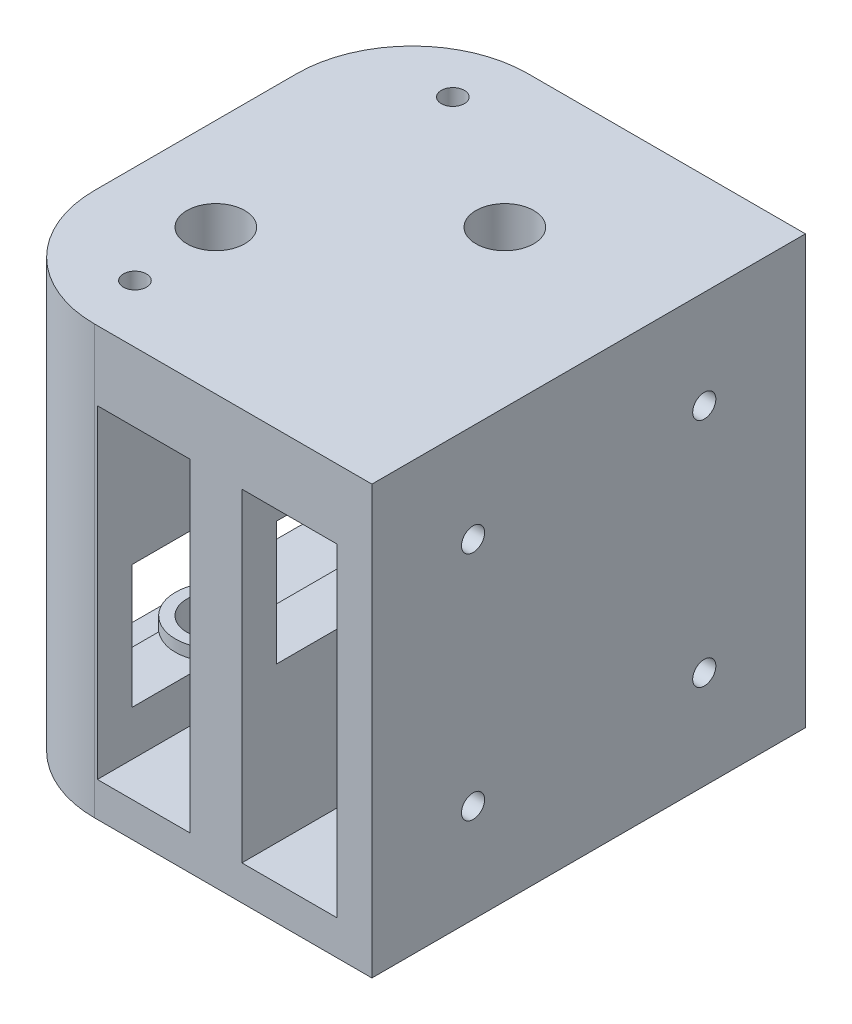
from build123d import *
from build123d.topology import SkipClean

# Parameters (mm, degrees)
TOP_SKETCH1_W                             = 34
TOP_SKETCH1_H                             = 37.5
TOP_SKETCH1_R                             = 1
TOP_SKETCH1_R_2                           = 2.5
BOSS_EXTRUDE4_DEPTH                       = 6
TOPRIGHTRISERBOSS_EXTRUDE5_START          = 14.4
TOPRIGHTRISER_R                           = 2.5
TOPRIGHTRISERBOSS_EXTRUDE5_DEPTH          = 14.4
TOPLEFTBOSS_EXTRUDE6_START                = 4.9
TOPLEFT_R                                 = 2.5
TOPLEFTBOSS_EXTRUDE6_DEPTH                = 4.9
MIDWALL_W                                 = 10.25
MIDWALL_H                                 = 3
MIDWALL_W_2                               = 4.5
MIDWALL_W_3                               = 3
MIDWALL_H_2                               = 37.5
MIDWALLBOSS_EXTRUDE7_DEPTH                = 28
BOTTOM_W                                  = 34
BOTTOM_H                                  = 37.5
BOTTOMBOSS_EXTRUDE8_DEPTH                 = 3
LOWERRIGHT_R                              = 2.5
LOWERRIGHTBOSS_EXTRUDE10_DEPTH            = 4.9
LOWERLEFT_R                               = 2.5
LOWERLEFTBOSS_EXTRUDE9_DEPTH              = 14.4
FILLET1_R                                 = 10
LINEARRAILMOUNTINGHOLES_SKETCH10_R        = 1
LINEARRAILMOUNTINGHOLESCUT_EXTRUDE1_DEPTH = 3
TOPRIGHTINSET_CUT_EXTRUDE1_DEPTH          = 1
TOPLEFTINSET_CUT_EXTRUDE2_DEPTH           = 1
LOWERLEFTINSET_CUT_EXTRUDE3_START         = -1
LOWERLEFTINSET_CUT_EXTRUDE3_DEPTH         = 1
LOWERRIGHTINSETCUT_EXTRUDE4_START         = -1
LOWERRIGHTINSETCUT_EXTRUDE4_DEPTH         = 1
PUSHPINHOLESKETCH1_R                      = 1
PUSHPINHOLECUT_EXTRUDE5_DEPTH             = 63.69968102


with BuildPart() as part:
    # Top-Sketch1 → Boss-Extrude4 (new body)
    with BuildSketch(Plane(origin=(0, 0, 0), x_dir=(1, 0, 0), z_dir=(0, 1, 0))):
        with Locations((17, 18.75)):
            Rectangle(TOP_SKETCH1_W, TOP_SKETCH1_H)
        with Locations(Location((8.5, 32.5, 0), (0, 0, 270))):
            Circle(TOP_SKETCH1_R, mode=Mode.SUBTRACT)
        with Locations(Location((8.5, 5, 0), (0, 0, 270))):
            Circle(TOP_SKETCH1_R, mode=Mode.SUBTRACT)
        with Locations(Location((8, 12.5, 0), (0, 0, 270))):
            Circle(TOP_SKETCH1_R_2, mode=Mode.SUBTRACT)
        with Locations(Location((20.5, 25, 0), (0, 0, 270))):
            Circle(TOP_SKETCH1_R_2, mode=Mode.SUBTRACT)
    extrude(amount=BOSS_EXTRUDE4_DEPTH)

    # TopRightRiser → TopRightRiserBoss-Extrude5 (add)
    with SkipClean():  # the faces are left unmerged after this step: merging them gives an invalid solid
        with BuildSketch(Plane.XZ.offset(TOPRIGHTRISERBOSS_EXTRUDE5_START)):
            with BuildLine():
                Line((5.75, -9.819048676), (5.75, 0))
                Line((5.75, 0), (10.25, 0))
                Line((10.25, 0), (10.25, -9.819048676))
                ThreePointArc((10.25, -9.819048676), (8, -16), (5.75, -9.819048676))
            make_face()
            with Locations(Location((8, -12.5, 0), (0, 0, 270))):
                Circle(TOPRIGHTRISER_R, mode=Mode.SUBTRACT)
        extrude(amount=-TOPRIGHTRISERBOSS_EXTRUDE5_DEPTH)

    # TopLeft → TopLeftBoss-Extrude6 (add)
    with SkipClean():  # the faces are left unmerged after this step: merging them gives an invalid solid
        with BuildSketch(Plane.XZ.offset(TOPLEFTBOSS_EXTRUDE6_START)):
            with BuildLine():
                Line((18.25, -22.319048676), (18.25, 0))
                Line((18.25, 0), (22.75, 0))
                Line((22.75, 0), (22.75, -22.319048676))
                ThreePointArc((22.75, -22.319048676), (20.5, -28.5), (18.25, -22.319048676))
            make_face()
            with Locations(Location((20.5, -25, 0), (0, 0, 270))):
                Circle(TOPLEFT_R, mode=Mode.SUBTRACT)
        extrude(amount=-TOPLEFTBOSS_EXTRUDE6_DEPTH)

    # MidWall → MidWallBoss-Extrude7 (add)
    with SkipClean():  # the faces are left unmerged after this step: merging them gives an invalid solid
        with BuildSketch(Plane(origin=(0, 0, 0), x_dir=(-1, 0, 0), z_dir=(0, -1, 0))):
            with Locations((-5.125, 1.5)):
                Rectangle(MIDWALL_W, MIDWALL_H)
            with Locations((-20.5, 1.5)):
                Rectangle(MIDWALL_W_2, MIDWALL_H)
            with Locations((-32.5, 18.75)):
                Rectangle(MIDWALL_W_3, MIDWALL_H_2)
        extrude(amount=MIDWALLBOSS_EXTRUDE7_DEPTH)

    # Bottom → BottomBoss-Extrude8 (add)
    with SkipClean():  # the faces are left unmerged after this step: merging them gives an invalid solid
        with BuildSketch(Plane.XZ.offset(28)):
            with Locations((17, -18.75)):
                Rectangle(BOTTOM_W, BOTTOM_H)
        extrude(amount=BOTTOMBOSS_EXTRUDE8_DEPTH)

    # LowerRight → LowerRightBoss-Extrude10 (add)
    with SkipClean():  # the faces are left unmerged after this step: merging them gives an invalid solid
        with BuildSketch(Plane(origin=(0, -28, 0), x_dir=(1, 0, 0), z_dir=(0, 1, 0))):
            with BuildLine():
                Line((5.75, 9.819048676), (5.75, 3))
                Line((5.75, 3), (10.25, 3))
                Line((10.25, 3), (10.25, 9.819048676))
                ThreePointArc((10.25, 9.819048676), (8, 16), (5.75, 9.819048676))
            make_face()
            with Locations(Location((8, 12.5, 0), (0, 0, 90))):
                Circle(LOWERRIGHT_R, mode=Mode.SUBTRACT)
        extrude(amount=LOWERRIGHTBOSS_EXTRUDE10_DEPTH)

    # LowerLeft → LowerLeftBoss-Extrude9 (add)
    with SkipClean():  # the faces are left unmerged after this step: merging them gives an invalid solid
        with BuildSketch(Plane(origin=(0, -28, 0), x_dir=(1, 0, 0), z_dir=(0, 1, 0))):
            with BuildLine():
                Line((18.25, 0), (22.75, 0))
                Line((22.75, 0), (22.75, 22.319048676))
                ThreePointArc((22.75, 22.319048676), (20.5, 28.5), (18.25, 22.319048676))
                Line((18.25, 22.319048676), (18.25, 0))
            make_face()
            with Locations(Location((20.5, 25, 0), (0, 0, 90))):
                Circle(LOWERLEFT_R, mode=Mode.SUBTRACT)
        extrude(amount=LOWERLEFTBOSS_EXTRUDE9_DEPTH)

    # Fillet1
    # the kernel refuses this fillet: 10 mm, written as the material it takes off along each edge
    with BuildSketch(Plane(origin=(0, 0, 0), x_dir=(1, 0, 0), z_dir=(0, -1, 0)), Plane(origin=(0, -28, 0), x_dir=(1, 0, 0), z_dir=(0, -1, 0))) as fillet1_piece_1:
        with BuildLine():
            CenterArc((FILLET1_R, -FILLET1_R), FILLET1_R, 90, 90)
            Line((0, -FILLET1_R), (0, 0))
            Line((0, 0), (FILLET1_R, 0))
        make_face()
    extrude(amount=28, mode=Mode.SUBTRACT)
    with BuildSketch(Plane(origin=(0, -3, -37.5), x_dir=(0, 0, 1), z_dir=(0, -1, 0))) as fillet1_piece_2:
        with BuildLine():
            CenterArc((FILLET1_R, -FILLET1_R), FILLET1_R, 90, 90)
            Line((0, -FILLET1_R), (0, 0))
            Line((0, 0), (FILLET1_R, 0))
        make_face()
    extrude(amount=53, mode=Mode.SUBTRACT)
    with BuildSketch(Plane(origin=(0, -25, -37.5), x_dir=(0, 0, 1), z_dir=(0, 1, 0))) as fillet1_piece_3:
        with BuildLine():
            CenterArc((FILLET1_R, FILLET1_R), FILLET1_R, 180, 90)
            Line((0, FILLET1_R), (0, 0))
            Line((0, 0), (FILLET1_R, 0))
        make_face()
    extrude(amount=56, mode=Mode.SUBTRACT)
    with BuildSketch(Plane(origin=(0, 0, 0), x_dir=(1, 0, 0), z_dir=(0, 1, 0))) as fillet1_piece_4:
        with BuildLine():
            CenterArc((FILLET1_R, FILLET1_R), FILLET1_R, 180, 90)
            Line((0, FILLET1_R), (0, 0))
            Line((0, 0), (FILLET1_R, 0))
        make_face()
    extrude(amount=31, mode=Mode.SUBTRACT)

    # LinearRailMountingHoles-Sketch10 → LinearRailMountingHolesCut-Extrude1 (cut)
    with BuildSketch(Plane(origin=(34, 0, 0), x_dir=(0, 0, -1), z_dir=(1, 0, 0))):
        with Locations((8.75, -2.5)):
            Circle(LINEARRAILMOUNTINGHOLES_SKETCH10_R)
        with Locations((8.75, -22.5)):
            Circle(LINEARRAILMOUNTINGHOLES_SKETCH10_R)
        with Locations((28.75, -22.5)):
            Circle(LINEARRAILMOUNTINGHOLES_SKETCH10_R)
        with Locations((28.75, -2.5)):
            Circle(LINEARRAILMOUNTINGHOLES_SKETCH10_R)
    extrude(amount=-LINEARRAILMOUNTINGHOLESCUT_EXTRUDE1_DEPTH, mode=Mode.SUBTRACT)

    # TopRightInset-Sketch1 → TopRightInset-Cut-Extrude1 (cut)
    with BuildSketch(Plane.XZ.offset(14.4)):
        with BuildLine():
            Line((5.75, -9.819048676), (5.75, -3))
            Line((5.75, -3), (10.25, -3))
            Line((10.25, -3), (10.25, -9.819048676))
            ThreePointArc((10.25, -9.819048676), (8, -9), (5.75, -9.819048676))
        make_face()
    extrude(amount=-TOPRIGHTINSET_CUT_EXTRUDE1_DEPTH, mode=Mode.SUBTRACT)

    # TopLeftInset-Sketch2 → TopLeftInset-Cut-Extrude2 (cut)
    with BuildSketch(Plane.XZ.offset(4.9)):
        with BuildLine():
            Line((18.25, -22.319048676), (18.25, -3))
            Line((18.25, -3), (22.75, -3))
            Line((22.75, -3), (22.75, -22.319048676))
            ThreePointArc((22.75, -22.319048676), (20.5, -21.5), (18.25, -22.319048676))
        make_face()
    extrude(amount=-TOPLEFTINSET_CUT_EXTRUDE2_DEPTH, mode=Mode.SUBTRACT)

    # LowerLeftInset-Sketch3 → LowerLeftInset-Cut-Extrude3 (cut)
    with BuildSketch(Plane(origin=(0, -13.6, 0), x_dir=(1, 0, 0), z_dir=(0, 1, 0)).offset(LOWERLEFTINSET_CUT_EXTRUDE3_START)):
        with BuildLine():
            Line((18.25, 22.319048676), (18.25, 3))
            Line((18.25, 3), (22.75, 3))
            Line((22.75, 3), (22.75, 22.319048676))
            ThreePointArc((22.75, 22.319048676), (20.5, 21.5), (18.25, 22.319048676))
        make_face()
    extrude(amount=LOWERLEFTINSET_CUT_EXTRUDE3_DEPTH, mode=Mode.SUBTRACT)

    # LowerRightInset-Sketch4 → LowerRightInsetCut-Extrude4 (cut)
    with BuildSketch(Plane(origin=(0, -23.1, 0), x_dir=(1, 0, 0), z_dir=(0, 1, 0)).offset(LOWERRIGHTINSETCUT_EXTRUDE4_START)):
        with BuildLine():
            Line((5.75, 9.819048676), (5.75, 3))
            Line((5.75, 3), (10.25, 3))
            Line((10.25, 3), (10.25, 9.819048676))
            ThreePointArc((10.25, 9.819048676), (8, 9), (5.75, 9.819048676))
        make_face()
    extrude(amount=LOWERRIGHTINSETCUT_EXTRUDE4_DEPTH, mode=Mode.SUBTRACT)

    # PushPinHoleSketch1 → PushPinHoleCut-Extrude5 (cut, through all)
    with BuildSketch(Plane.XZ.offset(31)):
        with Locations(Location((20.5, -25, 0), (0, 0, 270))):
            Circle(PUSHPINHOLESKETCH1_R)
        with Locations(Location((8, -12.5, 0), (0, 0, 270))):
            Circle(PUSHPINHOLESKETCH1_R)
    extrude(amount=-PUSHPINHOLECUT_EXTRUDE5_DEPTH, mode=Mode.SUBTRACT)


solid = part.part
